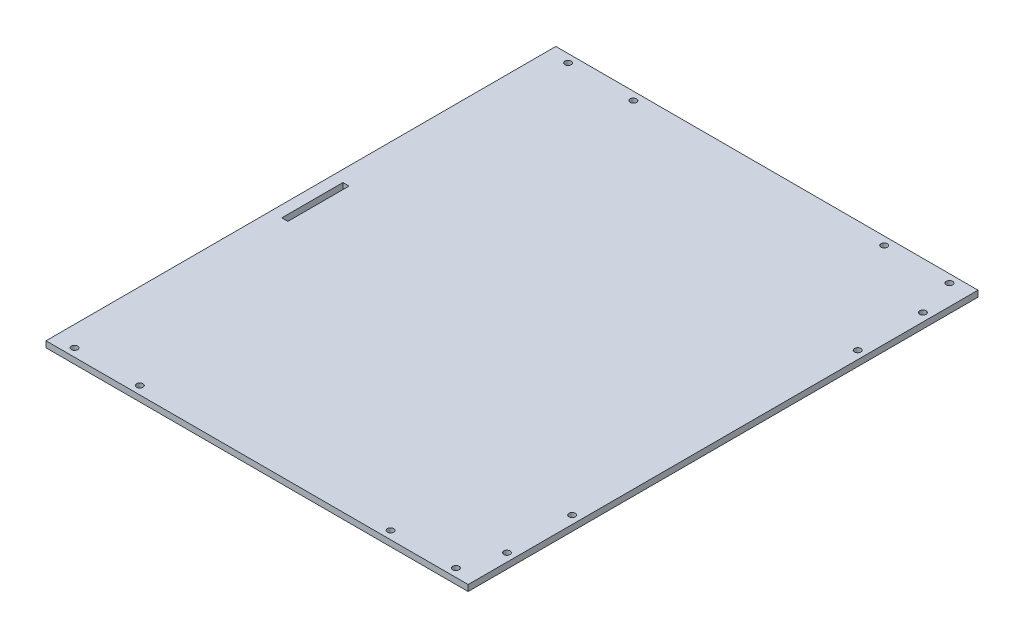
from build123d import *

# Parameters (mm, degrees)
SKETCH1_W           = 207
SKETCH1_H           = 250
SKETCH1_R           = 1.55
SKETCH1_W_2         = 3
SKETCH1_H_2         = 30
BOSS_EXTRUDE1_DEPTH = 3


with BuildPart() as part:
    # Sketch1 → Boss-Extrude1 (new body)
    with BuildSketch(Plane(origin=(0, 0, 0), x_dir=(1, 0, 0), z_dir=(0, 1, 0))):
        with Locations((103.5, 125)):
            Rectangle(SKETCH1_W, SKETCH1_H)
        with Locations((10, 4)):
            Circle(SKETCH1_R, mode=Mode.SUBTRACT)
        with Locations((42, 4)):
            Circle(SKETCH1_R, mode=Mode.SUBTRACT)
        with Locations((42, 246)):
            Circle(SKETCH1_R, mode=Mode.SUBTRACT)
        with Locations((10, 246)):
            Circle(SKETCH1_R, mode=Mode.SUBTRACT)
        with Locations((165, 4)):
            Circle(SKETCH1_R, mode=Mode.SUBTRACT)
        with Locations((197, 4)):
            Circle(SKETCH1_R, mode=Mode.SUBTRACT)
        with Locations((165, 246)):
            Circle(SKETCH1_R, mode=Mode.SUBTRACT)
        with Locations((197, 246)):
            Circle(SKETCH1_R, mode=Mode.SUBTRACT)
        with Locations((203, 23)):
            Circle(SKETCH1_R, mode=Mode.SUBTRACT)
        with Locations((203, 55)):
            Circle(SKETCH1_R, mode=Mode.SUBTRACT)
        with Locations((203, 227)):
            Circle(SKETCH1_R, mode=Mode.SUBTRACT)
        with Locations((203, 195)):
            Circle(SKETCH1_R, mode=Mode.SUBTRACT)
        with Locations((7.1, 125)):
            Rectangle(SKETCH1_W_2, SKETCH1_H_2, mode=Mode.SUBTRACT)
    extrude(amount=BOSS_EXTRUDE1_DEPTH)


solid = part.part
